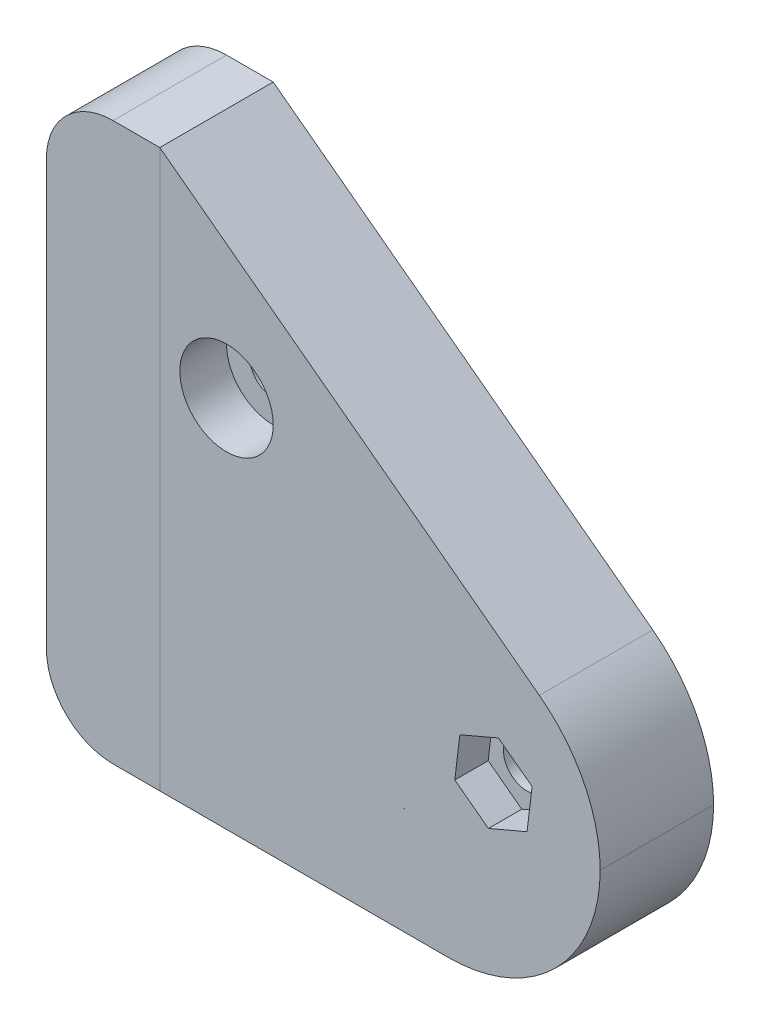
from build123d import *

# Parameters (mm, degrees)
SKETCH1_R           = 1.75
BOSS_EXTRUDE1_DEPTH = 8.5
CUT_EXTRUDE2_DEPTH  = 2.5
CUT_EXTRUDE3_DEPTH  = 2.5
SKETCH5_R           = 3.5
CUT_EXTRUDE4_DEPTH  = 3.5
SKETCH6_R           = 3.5
CUT_EXTRUDE5_DEPTH  = 3.5
FILLET1_R           = 11.4
SKETCH7_W           = 8.501662988
SKETCH7_H           = 41.75
BOSS_EXTRUDE3_DEPTH = 8.5
FILLET2_R           = 5
FILLET3_R           = 5


with BuildPart() as part:
    # Sketch1 → Boss-Extrude1 (new body)
    with BuildSketch(Plane.XY):
        Polygon((8, -10), (8, -27), (-25, -27), (-25, 14.75), align=None)
        with Locations((-20, 1)):
            Circle(SKETCH1_R, mode=Mode.SUBTRACT)
        with Locations((0, -14)):
            Circle(SKETCH1_R, mode=Mode.SUBTRACT)
        Polygon((-6.687894354, -19), (-6.666666667, -19), (-6.687894354, -18.984079234), align=None, mode=Mode.SUBTRACT)
    extrude(amount=BOSS_EXTRUDE1_DEPTH)

    # Sketch3 → Cut-Extrude2 (cut)
    with BuildSketch(Plane(origin=(0, 0, 0), x_dir=(-1, 0, 0), z_dir=(0, 0, -1))):
        Polygon((22.725, 2.573279484), (20, 4.146558967), (17.275, 2.573279484), (17.275, -0.573279484), (20, -2.146558967), (22.725, -0.573279484), align=None)
    extrude(amount=-CUT_EXTRUDE2_DEPTH, mode=Mode.SUBTRACT)

    # Sketch4 → Cut-Extrude3 (cut)
    with BuildSketch(Plane.XY.offset(8.5)):
        Polygon((-2.517247174, -12.11206462), (-2.893623587, -15.23603231), (-0.376376413, -17.12396769), (2.517247174, -15.88793538), (2.893623587, -12.76396769), (0.376376413, -10.87603231), align=None)
    extrude(amount=-CUT_EXTRUDE3_DEPTH, mode=Mode.SUBTRACT)

    # Sketch5 → Cut-Extrude4 (cut)
    with BuildSketch(Plane.XY.offset(8.5)):
        with Locations((-20, 1)):
            Circle(SKETCH5_R)
    extrude(amount=-CUT_EXTRUDE4_DEPTH, mode=Mode.SUBTRACT)

    # Sketch6 → Cut-Extrude5 (cut)
    with BuildSketch(Plane(origin=(0, 0, 0), x_dir=(-1, 0, 0), z_dir=(0, 0, -1))):
        with Locations((0, -14)):
            Circle(SKETCH6_R)
    extrude(amount=-CUT_EXTRUDE5_DEPTH, mode=Mode.SUBTRACT)

    # Fillet1
    # the kernel refuses this fillet: 11.4 mm, written as the material it takes off along each edge
    with BuildSketch(Plane(origin=(8, -10, -14.25), x_dir=(0, -1, 0), z_dir=(0, 0, 1))) as fillet1_piece_1:
        with BuildLine():
            CenterArc((FILLET1_R * 0.5, -FILLET1_R), FILLET1_R, 90, 53.130102354)
            Line((-FILLET1_R * 0.3, -FILLET1_R * 0.4), (0, 0))
            Line((0, 0), (FILLET1_R * 0.5, 0))
        make_face()
    extrude(amount=37, mode=Mode.SUBTRACT)
    with BuildSketch(Plane(origin=(8, -27, -28.5), x_dir=(0, 1, 0), z_dir=(0, 0, 1))) as fillet1_piece_2:
        with BuildLine():
            CenterArc((FILLET1_R, FILLET1_R), FILLET1_R, 180, 90)
            Line((0, FILLET1_R), (0, 0))
            Line((0, 0), (FILLET1_R, 0))
        make_face()
    extrude(amount=65.5, mode=Mode.SUBTRACT)

    # Sketch7 → Boss-Extrude3 (add)
    with BuildSketch(Plane.ZY.offset(25)):
        with Locations((4.25, -6.125)):
            Rectangle(SKETCH7_W, SKETCH7_H)
    extrude(amount=BOSS_EXTRUDE3_DEPTH)

    # Fillet2
    fillet2_edges = [part.edges().sort_by_distance(p)[0] for p in [
        (-33.5, -27, 4.25),
    ]]
    fillet(fillet2_edges, radius=FILLET2_R)

    # Fillet3
    fillet3_edges = [part.edges().sort_by_distance(p)[0] for p in [
        (-33.5, 14.75, 4.25),
    ]]
    fillet(fillet3_edges, radius=FILLET3_R)


solid = part.part
